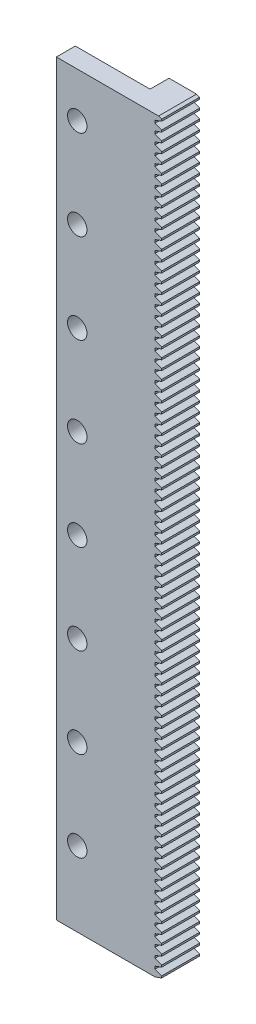
from build123d import *

# Parameters (mm, degrees)
SKETCH2_R           = 1.625
BOSS_EXTRUDE1_DEPTH = 6.35
SKETCH2_3_W         = 12.5
SKETCH2_3_H         = 125
SKETCH2_3_R         = 1.1
CUT_EXTRUDE1_DEPTH  = 3.175


with BuildPart() as part:
    # Sketch2 → Boss-Extrude1 (new body)
    with BuildSketch(Plane.XY):
        Polygon((-3.5, -62.5), (13, -62.5), (14.125, -62.090533486), (14.125, -61.783105558), (13, -61.373639045), (13, -60.929203675), (14.125, -60.519737161), (14.125, -60.212309233), (13, -59.80284272), (13, -59.35840735), (14.125, -58.948940836), (14.125, -58.641512908), (13, -58.232046395), (13, -57.787611025), (14.125, -57.378144511), (14.125, -57.070716583), (13, -56.66125007), (13, -56.2168147), (14.125, -55.807348186), (14.125, -55.499920258), (13, -55.090453745), (13, -54.646018375), (14.125, -54.236551861), (14.125, -53.929123933), (13, -53.51965742), (13, -53.07522205), (14.125, -52.665755536), (14.125, -52.358327608), (13, -51.948861095), (13, -51.504425725), (14.125, -51.094959211), (14.125, -50.787531283), (13, -50.37806477), (13, -49.9336294), (14.125, -49.524162886), (14.125, -49.216734958), (13, -48.807268445), (13, -48.362833075), (14.125, -47.953366561), (14.125, -47.645938633), (13, -47.23647212), (13, -46.79203675), (14.125, -46.382570236), (14.125, -46.075142308), (13, -45.665675795), (13, -45.221240425), (14.125, -44.811773911), (14.125, -44.504345983), (13, -44.09487947), (13, -43.6504441), (14.125, -43.240977586), (14.125, -42.933549658), (13, -42.524083145), (13, -42.079647775), (14.125, -41.670181261), (14.125, -41.362753333), (13, -40.95328682), (13, -40.50885145), (14.125, -40.099384936), (14.125, -39.791957008), (13, -39.382490495), (13, -38.938055125), (14.125, -38.528588611), (14.125, -38.221160683), (13, -37.81169417), (13, -37.3672588), (14.125, -36.957792286), (14.125, -36.650364358), (13, -36.240897845), (13, -35.796462475), (14.125, -35.386995961), (14.125, -35.079568033), (13, -34.67010152), (13, -34.22566615), (14.125, -33.816199636), (14.125, -33.508771708), (13, -33.099305195), (13, -32.654869825), (14.125, -32.245403311), (14.125, -31.937975383), (13, -31.52850887), (13, -31.0840735), (14.125, -30.674606986), (14.125, -30.367179058), (13, -29.957712545), (13, -29.513277175), (14.125, -29.103810661), (14.125, -28.796382733), (13, -28.38691622), (13, -27.94248085), (14.125, -27.533014336), (14.125, -27.225586408), (13, -26.816119895), (13, -26.371684525), (14.125, -25.962218011), (14.125, -25.654790083), (13, -25.24532357), (13, -24.8008882), (14.125, -24.391421686), (14.125, -24.083993758), (13, -23.674527245), (13, -23.230091875), (14.125, -22.820625361), (14.125, -22.513197433), (13, -22.10373092), (13, -21.65929555), (14.125, -21.249829036), (14.125, -20.942401108), (13, -20.532934595), (13, -20.088499225), (14.125, -19.679032711), (14.125, -19.371604783), (13, -18.96213827), (13, -18.5177029), (14.125, -18.108236386), (14.125, -17.800808458), (13, -17.391341945), (13, -16.946906575), (14.125, -16.537440061), (14.125, -16.230012133), (13, -15.82054562), (13, -15.37611025), (14.125, -14.966643736), (14.125, -14.659215808), (13, -14.249749295), (13, -13.805313925), (14.125, -13.395847411), (14.125, -13.088419483), (13, -12.67895297), (13, -12.2345176), (14.125, -11.825051086), (14.125, -11.517623158), (13, -11.108156645), (13, -10.663721275), (14.125, -10.254254761), (14.125, -9.946826833), (13, -9.53736032), (13, -9.09292495), (14.125, -8.683458436), (14.125, -8.376030508), (13, -7.966563995), (13, -7.522128625), (14.125, -7.112662111), (14.125, -6.805234183), (13, -6.39576767), (13, -5.9513323), (14.125, -5.541865786), (14.125, -5.234437858), (13, -4.824971345), (13, -4.380535975), (14.125, -3.971069461), (14.125, -3.663641533), (13, -3.25417502), (13, -2.80973965), (14.125, -2.400273136), (14.125, -2.092845208), (13, -1.683378695), (13, -1.238943325), (14.125, -0.829476811), (14.125, -0.522048883), (13, -0.11258237), (13, 0.331853), (14.125, 0.741319514), (14.125, 1.048747442), (13, 1.458213955), (13, 1.902649325), (14.125, 2.312115839), (14.125, 2.619543767), (13, 3.02901028), (13, 3.47344565), (14.125, 3.882912164), (14.125, 4.190340092), (13, 4.599806605), (13, 5.044241975), (14.125, 5.453708489), (14.125, 5.761136417), (13, 6.17060293), (13, 6.6150383), (14.125, 7.024504814), (14.125, 7.331932742), (13, 7.741399255), (13, 8.185834625), (14.125, 8.595301139), (14.125, 8.902729067), (13, 9.31219558), (13, 9.75663095), (14.125, 10.166097464), (14.125, 10.473525392), (13, 10.882991905), (13, 11.327427275), (14.125, 11.736893789), (14.125, 12.044321717), (13, 12.45378823), (13, 12.8982236), (14.125, 13.307690114), (14.125, 13.615118042), (13, 14.024584555), (13, 14.469019925), (14.125, 14.878486439), (14.125, 15.185914367), (13, 15.59538088), (13, 16.03981625), (14.125, 16.449282764), (14.125, 16.756710692), (13, 17.166177205), (13, 17.610612575), (14.125, 18.020079089), (14.125, 18.327507017), (13, 18.73697353), (13, 19.1814089), (14.125, 19.590875414), (14.125, 19.898303342), (13, 20.307769855), (13, 20.752205225), (14.125, 21.161671739), (14.125, 21.469099667), (13, 21.87856618), (13, 22.32300155), (14.125, 22.732468064), (14.125, 23.039895992), (13, 23.449362505), (13, 23.893797875), (14.125, 24.303264389), (14.125, 24.610692317), (13, 25.02015883), (13, 25.4645942), (14.125, 25.874060714), (14.125, 26.181488642), (13, 26.590955155), (13, 27.035390525), (14.125, 27.444857039), (14.125, 27.752284967), (13, 28.16175148), (13, 28.60618685), (14.125, 29.015653364), (14.125, 29.323081292), (13, 29.732547805), (13, 30.176983175), (14.125, 30.586449689), (14.125, 30.893877617), (13, 31.30334413), (13, 31.7477795), (14.125, 32.157246014), (14.125, 32.464673942), (13, 32.874140455), (13, 33.318575825), (14.125, 33.728042339), (14.125, 34.035470267), (13, 34.44493678), (13, 34.88937215), (14.125, 35.298838664), (14.125, 35.606266592), (13, 36.015733105), (13, 36.460168475), (14.125, 36.869634989), (14.125, 37.177062917), (13, 37.58652943), (13, 38.0309648), (14.125, 38.440431314), (14.125, 38.747859242), (13, 39.157325755), (13, 39.601761125), (14.125, 40.011227639), (14.125, 40.318655567), (13, 40.72812208), (13, 41.17255745), (14.125, 41.582023964), (14.125, 41.889451892), (13, 42.298918405), (13, 42.743353775), (14.125, 43.152820289), (14.125, 43.460248217), (13, 43.86971473), (13, 44.3141501), (14.125, 44.723616614), (14.125, 45.031044542), (13, 45.440511055), (13, 45.884946425), (14.125, 46.294412939), (14.125, 46.601840867), (13, 47.01130738), (13, 47.45574275), (14.125, 47.865209264), (14.125, 48.172637192), (13, 48.582103705), (13, 49.026539075), (14.125, 49.436005589), (14.125, 49.743433517), (13, 50.15290003), (13, 50.5973354), (14.125, 51.006801914), (14.125, 51.314229842), (13, 51.723696355), (13, 52.168131725), (14.125, 52.577598239), (14.125, 52.885026167), (13, 53.29449268), (13, 53.73892805), (14.125, 54.148394564), (14.125, 54.455822492), (13, 54.865289005), (13, 55.309724375), (14.125, 55.719190889), (14.125, 56.026618817), (13, 56.43608533), (13, 56.8805207), (14.125, 57.289987214), (14.125, 57.597415142), (13, 58.006881655), (13, 58.451317025), (14.125, 58.860783539), (14.125, 59.168211467), (13, 59.57767798), (13, 60.02211335), (14.125, 60.431579864), (14.125, 60.739007792), (13, 61.148474305), (13, 61.592909675), (14.125, 62.002376189), (14.125, 62.309804117), (13.602441106, 62.5), (-3.5, 62.5), align=None)
        with Locations((0, -50)):
            Circle(SKETCH2_R, mode=Mode.SUBTRACT)
        with Locations((0, -35)):
            Circle(SKETCH2_R, mode=Mode.SUBTRACT)
        with Locations((0, -20)):
            Circle(SKETCH2_R, mode=Mode.SUBTRACT)
        with Locations((0, -5)):
            Circle(SKETCH2_R, mode=Mode.SUBTRACT)
        with Locations((0, 10)):
            Circle(SKETCH2_R, mode=Mode.SUBTRACT)
        with Locations((0, 25)):
            Circle(SKETCH2_R, mode=Mode.SUBTRACT)
        with Locations((0, 40)):
            Circle(SKETCH2_R, mode=Mode.SUBTRACT)
        with Locations((0, 55)):
            Circle(SKETCH2_R, mode=Mode.SUBTRACT)
    extrude(amount=BOSS_EXTRUDE1_DEPTH)

    # Sketch2<3> → Cut-Extrude1 (cut)
    with BuildSketch(Plane.XY):
        with Locations((2.75, 0)):
            Rectangle(SKETCH2_3_W, SKETCH2_3_H)
        with Locations((0, -50)):
            Circle(SKETCH2_3_R, mode=Mode.SUBTRACT)
        with Locations((0, -35)):
            Circle(SKETCH2_3_R, mode=Mode.SUBTRACT)
        with Locations((0, -20)):
            Circle(SKETCH2_3_R, mode=Mode.SUBTRACT)
        with Locations((0, -5)):
            Circle(SKETCH2_3_R, mode=Mode.SUBTRACT)
        with Locations((0, 10)):
            Circle(SKETCH2_3_R, mode=Mode.SUBTRACT)
        with Locations((0, 25)):
            Circle(SKETCH2_3_R, mode=Mode.SUBTRACT)
        with Locations((0, 40)):
            Circle(SKETCH2_3_R, mode=Mode.SUBTRACT)
        with Locations((0, 55)):
            Circle(SKETCH2_3_R, mode=Mode.SUBTRACT)
    extrude(amount=CUT_EXTRUDE1_DEPTH, mode=Mode.SUBTRACT)


solid = part.part
